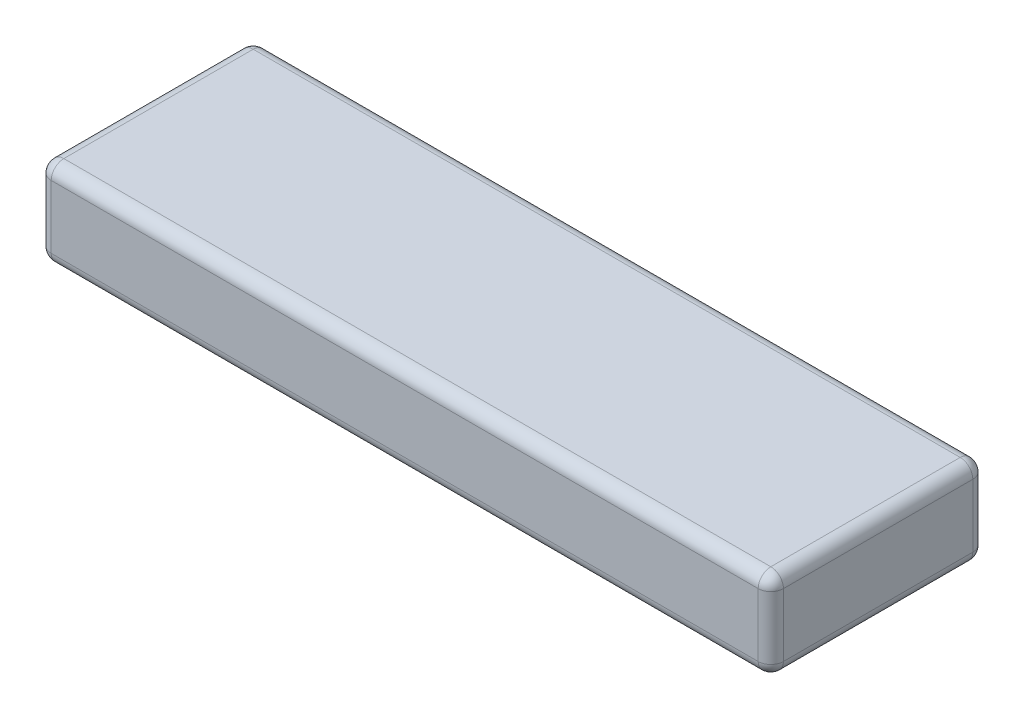
from build123d import *

# Parameters (mm, degrees)
ESBO_O1_W                = 116
ESBO_O1_H                = 34
RESSALTO_EXTRUS_O1_DEPTH = 14
FILETE1_R                = 2
FILETE2_R                = 2


with BuildPart() as part:
    # Esboço1 → Ressalto-extrusão1 (new body)
    with BuildSketch(Plane(origin=(0, 0, 0), x_dir=(1, 0, 0), z_dir=(0, 1, 0))):
        with Locations((58, 17)):
            Rectangle(ESBO_O1_W, ESBO_O1_H)
    extrude(amount=RESSALTO_EXTRUS_O1_DEPTH)

    # Filete1
    filete1_edges = [part.edges().sort_by_distance(p)[0] for p in [
        (116, 14, -17),
        (58, 14, -34),
        (0, 14, -17),
        (58, 0, -34),
        (116, 0, -17),
        (58, 0, 0),
        (0, 0, -17),
        (58, 14, 0),
    ]]
    fillet(filete1_edges, radius=FILETE1_R)

    # Filete2
    # the kernel refuses this fillet: 2 mm, written as the material it takes off along each edge
    with BuildSketch(Plane(origin=(2, 2, -32), x_dir=(0, 0, -1), z_dir=(-1, 0, 0))) as filete2_piece_1_section:
        Polygon((0, 0), (FILETE2_R, 0), (FILETE2_R, FILETE2_R), (0, FILETE2_R), align=None)
    filete2_piece_1 = extrude(amount=FILETE2_R, mode=Mode.PRIVATE)
    filete2_piece_1 = filete2_piece_1 - Plane(origin=(2, 2, -32), x_dir=(0, 0.7071067811865475, 0.7071067811865475), z_dir=(-1, 0, 0)) * Sphere(FILETE2_R, mode=Mode.PRIVATE)
    add(filete2_piece_1, mode=Mode.SUBTRACT)
    with BuildSketch(Plane(origin=(114, 2, -32), x_dir=(0, 0, -1), z_dir=(1, 0, 0))) as filete2_piece_2_section:
        Polygon((0, 0), (FILETE2_R, 0), (FILETE2_R, -FILETE2_R), (0, -FILETE2_R), align=None)
    filete2_piece_2 = extrude(amount=FILETE2_R, mode=Mode.PRIVATE)
    filete2_piece_2 = filete2_piece_2 - Plane(origin=(114, 2, -32), x_dir=(0, 0.7071067811865475, 0.7071067811865475), z_dir=(1, 0, 0)) * Sphere(FILETE2_R, mode=Mode.PRIVATE)
    add(filete2_piece_2, mode=Mode.SUBTRACT)
    with BuildSketch(Plane(origin=(2, 2, -2), x_dir=(-1, 0, 0), z_dir=(0, 0, 1))) as filete2_piece_3_section:
        Polygon((0, 0), (FILETE2_R, 0), (FILETE2_R, FILETE2_R), (0, FILETE2_R), align=None)
    filete2_piece_3 = extrude(amount=FILETE2_R, mode=Mode.PRIVATE)
    filete2_piece_3 = filete2_piece_3 - Plane(origin=(2, 2, -2), x_dir=(0.7071067811865475, 0.7071067811865475, 0), z_dir=(0, 0, 1)) * Sphere(FILETE2_R, mode=Mode.PRIVATE)
    add(filete2_piece_3, mode=Mode.SUBTRACT)
    with BuildSketch(Plane(origin=(114, 2, -2), x_dir=(1, 0, 0), z_dir=(0, 0, 1))) as filete2_piece_4_section:
        Polygon((0, 0), (FILETE2_R, 0), (FILETE2_R, -FILETE2_R), (0, -FILETE2_R), align=None)
    filete2_piece_4 = extrude(amount=FILETE2_R, mode=Mode.PRIVATE)
    filete2_piece_4 = filete2_piece_4 - Plane(origin=(114, 2, -2), x_dir=(-0.7071067811865475, 0.7071067811865475, 2.06882771026568e-15), z_dir=(0, 0, 1)) * Sphere(FILETE2_R, mode=Mode.PRIVATE)
    add(filete2_piece_4, mode=Mode.SUBTRACT)
    with BuildSketch(Plane(origin=(114, 12, -2), x_dir=(1, 0, 0), z_dir=(0, 0, 1))) as filete2_piece_5_section:
        Polygon((0, 0), (FILETE2_R, 0), (FILETE2_R, FILETE2_R), (0, FILETE2_R), align=None)
    filete2_piece_5 = extrude(amount=FILETE2_R, mode=Mode.PRIVATE)
    filete2_piece_5 = filete2_piece_5 - Plane(origin=(114, 12, -2), x_dir=(-0.7071067811865475, -0.7071067811865475, 2.06882771026568e-15), z_dir=(0, 0, 1)) * Sphere(FILETE2_R, mode=Mode.PRIVATE)
    add(filete2_piece_5, mode=Mode.SUBTRACT)
    with BuildSketch(Plane(origin=(2, 12, -2), x_dir=(-1, 0, 0), z_dir=(0, 0, 1))) as filete2_piece_6_section:
        Polygon((0, 0), (FILETE2_R, 0), (FILETE2_R, -FILETE2_R), (0, -FILETE2_R), align=None)
    filete2_piece_6 = extrude(amount=FILETE2_R, mode=Mode.PRIVATE)
    filete2_piece_6 = filete2_piece_6 - Plane(origin=(2, 12, -2), x_dir=(0.7071067811865475, -0.7071067811865475, 0), z_dir=(0, 0, 1)) * Sphere(FILETE2_R, mode=Mode.PRIVATE)
    add(filete2_piece_6, mode=Mode.SUBTRACT)
    with BuildSketch(Plane(origin=(114, 12, -32), x_dir=(0, 0, -1), z_dir=(1, 0, 0))) as filete2_piece_7_section:
        Polygon((0, 0), (FILETE2_R, 0), (FILETE2_R, FILETE2_R), (0, FILETE2_R), align=None)
    filete2_piece_7 = extrude(amount=FILETE2_R, mode=Mode.PRIVATE)
    filete2_piece_7 = filete2_piece_7 - Plane(origin=(114, 12, -32), x_dir=(0, -0.7071067811865475, 0.7071067811865475), z_dir=(1, 0, 0)) * Sphere(FILETE2_R, mode=Mode.PRIVATE)
    add(filete2_piece_7, mode=Mode.SUBTRACT)
    with BuildSketch(Plane(origin=(2, 12, -32), x_dir=(0, 0, -1), z_dir=(-1, 0, 0))) as filete2_piece_8_section:
        Polygon((0, 0), (FILETE2_R, 0), (FILETE2_R, -FILETE2_R), (0, -FILETE2_R), align=None)
    filete2_piece_8 = extrude(amount=FILETE2_R, mode=Mode.PRIVATE)
    filete2_piece_8 = filete2_piece_8 - Plane(origin=(2, 12, -32), x_dir=(0, -0.7071067811865475, 0.7071067811865475), z_dir=(-1, 0, 0)) * Sphere(FILETE2_R, mode=Mode.PRIVATE)
    add(filete2_piece_8, mode=Mode.SUBTRACT)
    with BuildSketch(Plane(origin=(116, 2, 0), x_dir=(-1, 0, 0), z_dir=(0, 1, 0)), Plane(origin=(116, 2, -34), x_dir=(0, 0, 1), z_dir=(0, 1, 0))) as filete2_piece_9:
        with BuildLine():
            CenterArc((FILETE2_R, -FILETE2_R), FILETE2_R, 90, 90)
            Line((0, -FILETE2_R), (0, 0))
            Line((0, 0), (FILETE2_R, 0))
        make_face()
    extrude(amount=10, mode=Mode.SUBTRACT)
    with BuildSketch(Plane(origin=(0, 2, 0), x_dir=(1, 0, 0), z_dir=(0, 1, 0)), Plane(origin=(0, 2, -34), x_dir=(0, 0, 1), z_dir=(0, 1, 0))) as filete2_piece_10:
        with BuildLine():
            CenterArc((FILETE2_R, FILETE2_R), FILETE2_R, 180, 90)
            Line((0, FILETE2_R), (0, 0))
            Line((0, 0), (FILETE2_R, 0))
        make_face()
    extrude(amount=10, mode=Mode.SUBTRACT)


solid = part.part
